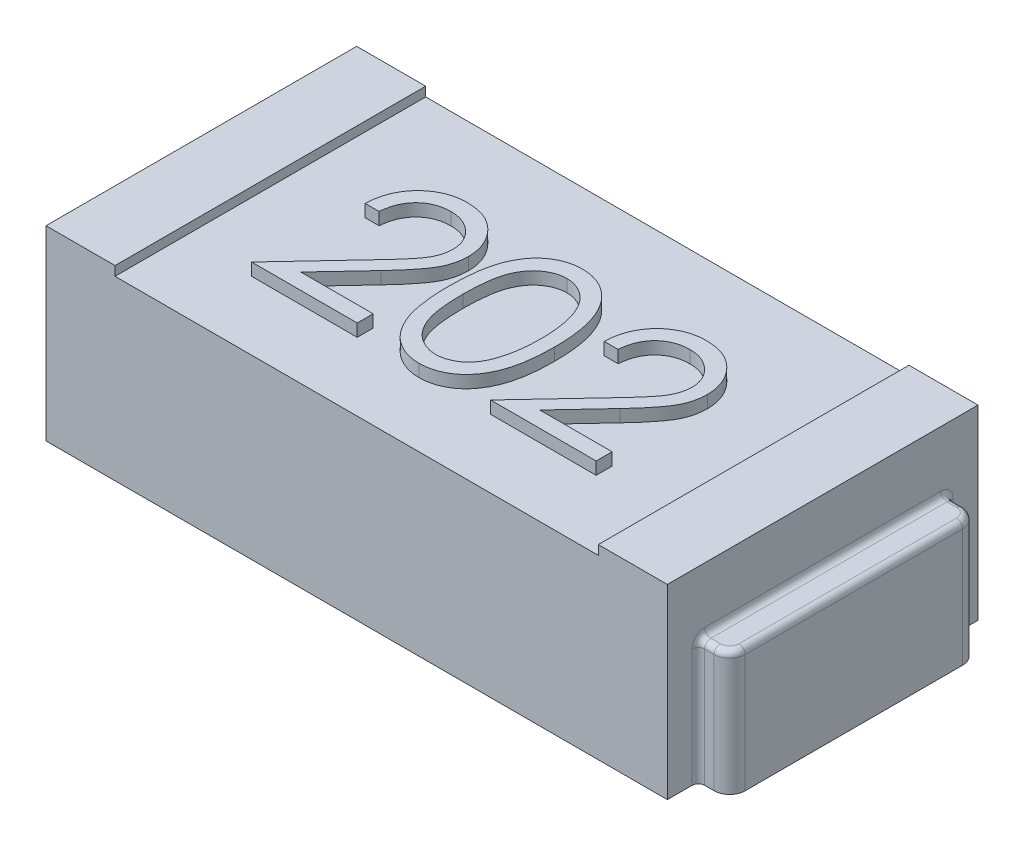
from build123d import *

# Parameters (mm, degrees)
ESQUISSE1_W             = 2
ESQUISSE1_H             = 1
BOSS_EXTRU_1_DEPTH      = 0.6
ESQUISSE2_W             = 1.555645222
ESQUISSE2_H             = 1
ENL_V_MAT_EXTRU_1_DEPTH = 0.03
BOSS_EXTRU_2_DEPTH      = 0.4
CONG_1_R                = 0.02
CONG_1_OF_SYM_TRIE2_R   = 0.02
BOSS_EXTRU_3_DEPTH      = 0.04


with BuildPart() as part:
    # Esquisse1 → Boss.-Extru.1 (new body)
    with BuildSketch(Plane(origin=(0, 0, 0), x_dir=(1, 0, 0), z_dir=(0, 1, 0))):
        Rectangle(ESQUISSE1_W, ESQUISSE1_H)
    extrude(amount=BOSS_EXTRU_1_DEPTH)

    # Esquisse2 → Enlèv. mat.-Extru.1 (cut)
    with BuildSketch(Plane(origin=(0, 0.6, 0), x_dir=(1, 0, 0), z_dir=(0, 1, 0))):
        Rectangle(ESQUISSE2_W, ESQUISSE2_H)
    extrude(amount=-ENL_V_MAT_EXTRU_1_DEPTH, mode=Mode.SUBTRACT)

    # Esquisse3 → Boss.-Extru.2 (add)
    with BuildSketch(Plane(origin=(0, 0, 0), x_dir=(1, 0, 0), z_dir=(0, 1, 0))):
        with BuildLine():
            Line((1, 0.4), (1.050552667, 0.4))
            ThreePointArc((1.050552667, 0.4), (1.085908006, 0.385355339), (1.100552667, 0.35))
            Line((1.100552667, 0.35), (1.100552667, -0.35))
            ThreePointArc((1.100552667, -0.35), (1.085908006, -0.385355339), (1.050552667, -0.4))
            Line((1.050552667, -0.4), (1, -0.4))
            Line((1, -0.4), (1, 0.4))
        make_face()
    boss_extru_2 = extrude(amount=BOSS_EXTRU_2_DEPTH)

    # Congé1
    cong_1_edges = [part.edges().sort_by_distance(p)[0] for p in [
        (1, 0.2, -0.4),
        (1, 0.2, 0.4),
        (1.025276334, 0.4, -0.4),
        (1.085908006, 0.4, -0.385355339),
        (1.100552667, 0.4, 0),
        (1.085908006, 0.4, 0.385355339),
        (1.025276334, 0.4, 0.4),
        (1, 0.4, 0),
    ]]
    fillet(cong_1_edges, radius=CONG_1_R)

    # Symétrie2: Boss.-Extru.2 across plane
    add(boss_extru_2.mirror(Plane(origin=(0, 0, 0), x_dir=(0, 0, 1), z_dir=(1, 0, 0))))

    # Congé1 of Symétrie2
    cong_1_of_sym_trie2_edges = [part.edges().sort_by_distance(p)[0] for p in [
        (-1, 0.2, -0.4),
        (-1, 0.2, 0.4),
        (-1.025276334, 0.4, -0.4),
        (-1.085908006, 0.4, -0.385355339),
        (-1.100552667, 0.4, 0),
        (-1.085908006, 0.4, 0.385355339),
        (-1.025276334, 0.4, 0.4),
        (-1, 0.4, 0),
    ]]
    fillet(cong_1_of_sym_trie2_edges, radius=CONG_1_OF_SYM_TRIE2_R)

    # Esquisse4 → Boss.-Extru.3 (add)
    # profile 1 of 3: a face of its own
    with BuildSketch(Plane(origin=(0, 0.57, 0), x_dir=(1, 0, 0), z_dir=(0, 1, 0))):
        with BuildLine():
            Line((0.275641026, 0.065854324), (0.230769231, 0.065854324))
            add(Edge.make_bspline(
                [(0.230769231, 0.065854324), (0.231061681, 0.071807307), (0.231636046, 0.08349881), (0.234325802, 0.100545082), (0.238174498, 0.116838625), (0.243616135, 0.132248612), (0.250374174, 0.146911299), (0.258478464, 0.160768444), (0.268077586, 0.173767185), (0.278964262, 0.18578702), (0.290788353, 0.196813816), (0.303546344, 0.206335994), (0.316952777, 0.214381375), (0.330966977, 0.221107267), (0.345747057, 0.226155816), (0.361158894, 0.229901765), (0.377270199, 0.232155528), (0.388247345, 0.232397784), (0.393830128, 0.23252099)],
                knots=[0, 0, 0, 0, 1.10065271, 2.161652631, 3.183658789, 4.190468796, 5.17591951, 6.163126047, 7.15150782, 8.156236427, 9.156009102, 10.134482811, 11.092018607, 12.041330605, 13.001268258, 13.972401359, 14.968799086, 16, 16, 16, 16], degree=3))
            add(Edge.make_bspline(
                [(0.393830128, 0.23252099), (0.39931271, 0.232392639), (0.410085788, 0.232140434), (0.425808933, 0.229974573), (0.440777118, 0.226582346), (0.454961085, 0.221823), (0.468247665, 0.215425225), (0.480736672, 0.207739862), (0.492576787, 0.198851315), (0.503234899, 0.188386485), (0.513021768, 0.177214715), (0.521464947, 0.165287872), (0.528695399, 0.152969403), (0.53472221, 0.140165374), (0.539158802, 0.126755227), (0.542527117, 0.112934198), (0.544431033, 0.098559225), (0.544723237, 0.088829717), (0.544871795, 0.08388317)],
                knots=[0, 0, 0, 0, 1.111607364, 2.184268762, 3.212621178, 4.221274766, 5.211760367, 6.196651075, 7.1921475, 8.207485113, 9.220403448, 10.201281604, 11.166441695, 12.114753415, 13.065576456, 14.026450734, 14.996634279, 16, 16, 16, 16], degree=3))
            add(Edge.make_bspline(
                [(0.544871795, 0.08388317), (0.5446299, 0.076919193), (0.544150356, 0.063113449), (0.540048302, 0.042825611), (0.533641657, 0.023169408), (0.525927749, 0.007349794), (0.518145972, -0.005397848), (0.511133471, -0.015893378), (0.502924212, -0.027194159), (0.493398712, -0.03926235), (0.482754016, -0.052192479), (0.470893707, -0.065976736), (0.45773321, -0.080472703), (0.448496281, -0.090373503), (0.443709936, -0.09550385)],
                knots=[0, 0, 0, 0, 1.184426356, 2.348067706, 3.509069118, 4.696110526, 5.333549288, 6.050745305, 6.844228056, 7.710549037, 8.667450064, 9.695053472, 10.805634456, 12, 12, 12, 12], degree=3))
            Line((0.443709936, -0.09550385), (0.318609776, -0.229017471))
            Line((0.318609776, -0.229017471), (0.551282051, -0.229017471))
            Line((0.551282051, -0.229017471), (0.551282051, -0.280299523))
            Line((0.551282051, -0.280299523), (0.211538462, -0.280299523))
            Line((0.211538462, -0.280299523), (0.405448718, -0.073368433))
            add(Edge.make_bspline(
                [(0.405448718, -0.073368433), (0.410169845, -0.068440103), (0.419238163, -0.058973791), (0.432064245, -0.045153368), (0.443584101, -0.032332005), (0.4538723, -0.020533927), (0.462705658, -0.00958656), (0.470544548, 0.000155541), (0.476825347, 0.009120462), (0.483641832, 0.019511978), (0.490243829, 0.032199452), (0.495917023, 0.047704265), (0.499376287, 0.063665301), (0.499791263, 0.074451306), (0.5, 0.079876759)],
                knots=[0, 0, 0, 0, 1.329631726, 2.553950428, 3.673215718, 4.687767853, 5.603093632, 6.413772471, 7.123043292, 7.734684054, 8.834405432, 9.900288307, 10.943827018, 12, 12, 12, 12], degree=3))
            add(Edge.make_bspline(
                [(0.5, 0.079876759), (0.49990918, 0.083288388), (0.49973019, 0.090012052), (0.498150519, 0.099870018), (0.495763304, 0.109379277), (0.492342553, 0.11856908), (0.487827304, 0.12734703), (0.482331107, 0.135723813), (0.47598967, 0.143822236), (0.468653774, 0.151415565), (0.460594985, 0.158370023), (0.452081521, 0.164530606), (0.443074363, 0.169679051), (0.433611489, 0.17389955), (0.423719279, 0.177210319), (0.413378601, 0.179504402), (0.402618027, 0.180944757), (0.395270385, 0.181139638), (0.391526442, 0.181238939)],
                knots=[0, 0, 0, 0, 0.991446411, 1.95395049, 2.89581595, 3.838931463, 4.798493298, 5.75982156, 6.748411868, 7.785213223, 8.824556874, 9.840280684, 10.836137867, 11.835679398, 12.848801643, 13.863922112, 14.911575587, 16, 16, 16, 16], degree=3))
            add(Edge.make_bspline(
                [(0.391526442, 0.181238939), (0.387616323, 0.181136791), (0.379937495, 0.180936191), (0.368663348, 0.179532953), (0.357908237, 0.177112119), (0.347645108, 0.173801165), (0.337856595, 0.169592801), (0.328590303, 0.164351123), (0.319867034, 0.158096338), (0.311670387, 0.15100483), (0.30411839, 0.143109459), (0.297483122, 0.134308036), (0.291685406, 0.124761262), (0.286626944, 0.114494898), (0.282518988, 0.103415786), (0.279379967, 0.091563257), (0.276896132, 0.078988774), (0.276066343, 0.07030519), (0.275641026, 0.065854324)],
                knots=[0, 0, 0, 0, 1.031018746, 2.02475058, 2.990194455, 3.934040569, 4.864654155, 5.795059489, 6.735614925, 7.690564532, 8.649604399, 9.611025574, 10.590972636, 11.591080095, 12.624614302, 13.701020113, 14.821632451, 16, 16, 16, 16], degree=3))
        make_face()
    # profile 2 of 3: a face of its own
    with BuildSketch(Plane(origin=(0, 0.57, 0), x_dir=(1, 0, 0), z_dir=(0, 1, 0))):
        with BuildLine():
            add(Edge.make_bspline(
                [(-0.173076923, -0.030499843), (-0.173030063, -0.022485931), (-0.172939038, -0.00691879), (-0.171926406, 0.01576473), (-0.170244214, 0.037044772), (-0.167938875, 0.056922352), (-0.16513345, 0.075402605), (-0.16138838, 0.092436141), (-0.157129408, 0.108101799), (-0.152193345, 0.122450663), (-0.14662366, 0.13567605), (-0.140561623, 0.148022507), (-0.133766653, 0.159471354), (-0.126627094, 0.170205324), (-0.11885394, 0.180048709), (-0.110668399, 0.189140518), (-0.101750988, 0.197270626), (-0.092404844, 0.20467724), (-0.082545349, 0.211170022), (-0.07245354, 0.216888984), (-0.062059953, 0.22177468), (-0.051336213, 0.225616171), (-0.040378704, 0.228789149), (-0.029149123, 0.230958998), (-0.017628929, 0.232324271), (-0.009853009, 0.232454795), (-0.005909455, 0.23252099)],
                knots=[0, 0, 0, 0, 1.646270934, 3.197905019, 4.663502075, 6.030701355, 7.308322542, 8.50163776, 9.611534131, 10.641858119, 11.616356847, 12.558055219, 13.465016945, 14.349605745, 15.204443733, 16.039544428, 16.859896111, 17.680448484, 18.487036065, 19.28249412, 20.06191084, 20.843045899, 21.620316918, 22.403196591, 23.190181807, 24, 24, 24, 24], degree=3))
            add(Edge.make_bspline(
                [(-0.005909455, 0.23252099), (-0.001932958, 0.232451302), (0.005975043, 0.232312715), (0.017666525, 0.230980723), (0.029087908, 0.228770563), (0.0401905, 0.225638995), (0.051065498, 0.221753898), (0.061627842, 0.21688431), (0.071943139, 0.211215901), (0.081847466, 0.204555347), (0.091449554, 0.197129307), (0.100513548, 0.18873464), (0.109040275, 0.179456109), (0.117136747, 0.169392986), (0.124573261, 0.158352259), (0.13165518, 0.146525958), (0.137994042, 0.133707263), (0.144098996, 0.120110053), (0.149368565, 0.105358102), (0.154120886, 0.089534565), (0.157960739, 0.072452538), (0.161159206, 0.054201646), (0.163637048, 0.034714862), (0.165441712, 0.01403396), (0.16639501, -0.007854667), (0.166574538, -0.022820074), (0.166666667, -0.030499843)],
                knots=[0, 0, 0, 0, 0.810914788, 1.612654377, 2.396697861, 3.181598691, 3.963628158, 4.749916497, 5.551656086, 6.361998678, 7.18212741, 8.025565596, 8.878627764, 9.750805457, 10.657531673, 11.591944965, 12.560506719, 13.57287815, 14.630710178, 15.753379473, 16.941251878, 18.199788006, 19.531962791, 20.947069417, 22.433333509, 24, 24, 24, 24], degree=3))
            add(Edge.make_bspline(
                [(0.166666667, -0.030499843), (0.166573583, -0.038146116), (0.166392214, -0.053044566), (0.165452398, -0.074834705), (0.163601165, -0.095405854), (0.161285453, -0.114807349), (0.158078172, -0.132958437), (0.154134577, -0.14992193), (0.14975596, -0.165771083), (0.144350989, -0.180376056), (0.138435173, -0.193940588), (0.131998717, -0.206607324), (0.125103027, -0.218488222), (0.117590349, -0.229488186), (0.109582719, -0.239685137), (0.100908749, -0.248899083), (0.091812951, -0.257352037), (0.082182606, -0.264873698), (0.072123813, -0.271457241), (0.061843945, -0.277344934), (0.051160605, -0.282092462), (0.040315897, -0.286168896), (0.029154702, -0.289283247), (0.017690932, -0.291436655), (0.005982898, -0.292946919), (-0.001931611, -0.29306213), (-0.005909455, -0.293120035)],
                knots=[0, 0, 0, 0, 1.561518951, 3.042555995, 4.452378317, 5.7783523, 7.031515105, 8.214008947, 9.334062868, 10.386615937, 11.391082383, 12.354592575, 13.286541444, 14.194233754, 15.072674879, 15.931287219, 16.775624067, 17.606195743, 18.42308326, 19.229000347, 20.022332153, 20.807536673, 21.593273796, 22.3848459, 23.188221202, 24, 24, 24, 24], degree=3))
            add(Edge.make_bspline(
                [(-0.005909455, -0.293120035), (-0.0098529, -0.293053413), (-0.017628604, -0.292922047), (-0.029150379, -0.291562943), (-0.040333585, -0.289377871), (-0.051233407, -0.286318356), (-0.061905766, -0.282573379), (-0.072205236, -0.277694282), (-0.082246333, -0.272075129), (-0.09200227, -0.265675783), (-0.101289721, -0.258344114), (-0.110160951, -0.25023493), (-0.118393096, -0.241145871), (-0.12605511, -0.231220454), (-0.133337123, -0.22054999), (-0.140035605, -0.208988794), (-0.146231441, -0.196582707), (-0.151894797, -0.183251577), (-0.156916034, -0.168800873), (-0.161351421, -0.153065276), (-0.164853444, -0.135905899), (-0.167851009, -0.117460561), (-0.170268778, -0.09765), (-0.171919396, -0.07646346), (-0.172939583, -0.053914145), (-0.173030308, -0.038447034), (-0.173076923, -0.030499843)],
                knots=[0, 0, 0, 0, 0.810891512, 1.598919785, 2.382837074, 3.152667961, 3.926044502, 4.706494248, 5.493654104, 6.291793342, 7.103789334, 7.925228297, 8.761435821, 9.622817696, 10.50288917, 11.416980706, 12.369136599, 13.353924996, 14.394355917, 15.514179734, 16.714354668, 17.994756427, 19.357759367, 20.818452758, 22.365282078, 24, 24, 24, 24], degree=3))
        make_face()
        with BuildLine():
            add(Edge.make_bspline(
                [(-0.128205128, -0.030299523), (-0.128188064, -0.036977908), (-0.128154947, -0.049939343), (-0.127289775, -0.068774095), (-0.126111171, -0.086341285), (-0.124590985, -0.102663218), (-0.122333421, -0.117684649), (-0.11980388, -0.131508889), (-0.116725582, -0.14406278), (-0.113083436, -0.155432467), (-0.108934994, -0.165810906), (-0.104405585, -0.175468222), (-0.099539767, -0.184518499), (-0.094094174, -0.192880443), (-0.088163451, -0.200581323), (-0.081881557, -0.207757442), (-0.075014045, -0.214157011), (-0.06551351, -0.221832276), (-0.052971157, -0.229763581), (-0.037168234, -0.236670165), (-0.020929884, -0.241010516), (-0.009908277, -0.241562481), (-0.004407051, -0.241837984)],
                knots=[0, 0, 0, 0, 1.459021318, 2.831673884, 4.118529203, 5.306027144, 6.411944654, 7.436330062, 8.375795394, 9.233974572, 10.042671642, 10.816086306, 11.563610507, 12.285937304, 12.993564865, 13.685989202, 14.367179055, 15.041617293, 16.353048772, 17.594441528, 18.799311195, 20, 20, 20, 20], degree=3))
            add(Edge.make_bspline(
                [(-0.004407051, -0.241837984), (0.001129759, -0.24160973), (0.012191948, -0.241153692), (0.028353919, -0.236753873), (0.044043957, -0.230115367), (0.056339949, -0.222265723), (0.065694598, -0.214790248), (0.072397025, -0.208416726), (0.078548746, -0.201280174), (0.084383328, -0.193580275), (0.089734625, -0.18516992), (0.094600787, -0.176089552), (0.099041266, -0.166313955), (0.101571129, -0.159489707), (0.102864583, -0.156000644)],
                knots=[0, 0, 0, 0, 1.353760809, 2.704726607, 4.075137775, 5.516104923, 6.260822281, 7.007110065, 7.778089737, 8.566572457, 9.372053459, 10.217411131, 11.088608312, 12, 12, 12, 12], degree=3))
            add(Edge.make_bspline(
                [(0.102864583, -0.156000644), (0.104371979, -0.151539253), (0.107432638, -0.142480715), (0.111377177, -0.128428765), (0.114483663, -0.113685513), (0.117278429, -0.098339068), (0.119186009, -0.082276253), (0.12072141, -0.06554677), (0.121625794, -0.048138004), (0.121737902, -0.036310148), (0.121794872, -0.030299523)],
                knots=[0, 0, 0, 0, 0.884706709, 1.796334032, 2.740027952, 3.714592787, 4.726048262, 5.777819803, 6.87074269, 8, 8, 8, 8], degree=3))
            add(Edge.make_bspline(
                [(0.121794872, -0.030299523), (0.121716273, -0.024289869), (0.121562518, -0.012533703), (0.120974805, 0.00468318), (0.119457152, 0.021035717), (0.117771564, 0.036594356), (0.115286246, 0.051272971), (0.11260656, 0.065194443), (0.109006386, 0.078186304), (0.105160704, 0.090451958), (0.100759219, 0.101852052), (0.095914114, 0.112439736), (0.090739577, 0.122266125), (0.085119257, 0.131304259), (0.079119874, 0.139594623), (0.072583081, 0.146970993), (0.065768171, 0.153661989), (0.056222858, 0.161299499), (0.043726531, 0.169086884), (0.028177153, 0.176253421), (0.011995633, 0.180368891), (0.001056568, 0.180949132), (-0.004407051, 0.181238939)],
                knots=[0, 0, 0, 0, 1.31362396, 2.569729283, 3.763502607, 4.902122613, 5.988968491, 7.01645872, 7.998833611, 8.933434873, 9.825090667, 10.667526885, 11.477055099, 12.250526234, 12.991942729, 13.710640831, 14.402115721, 15.076753259, 16.378508321, 17.609869233, 18.806226677, 20, 20, 20, 20], degree=3))
            add(Edge.make_bspline(
                [(-0.004407051, 0.181238939), (-0.009937136, 0.180948732), (-0.02100738, 0.18036779), (-0.037357087, 0.176268754), (-0.053029138, 0.169124045), (-0.06549242, 0.161273706), (-0.075044389, 0.153796804), (-0.081770488, 0.147313025), (-0.088077084, 0.140220703), (-0.093886756, 0.132449001), (-0.099328082, 0.124096805), (-0.104325369, 0.11509841), (-0.108827845, 0.105408216), (-0.112982779, 0.095034439), (-0.116636034, 0.083665733), (-0.119649458, 0.071127305), (-0.122433322, 0.057347035), (-0.124404075, 0.042244248), (-0.12615604, 0.025918226), (-0.127281947, 0.008307181), (-0.128157841, -0.01055916), (-0.12818905, -0.023587611), (-0.128205128, -0.030299523)],
                knots=[0, 0, 0, 0, 1.207732386, 2.417664972, 3.655092373, 4.956220595, 5.625982001, 6.301752483, 6.994047911, 7.697131622, 8.419323945, 9.170223765, 9.943494443, 10.752040957, 11.610060368, 12.549350801, 13.567764191, 14.679664412, 15.874934091, 17.154273443, 18.533957287, 20, 20, 20, 20], degree=3))
        make_face(mode=Mode.SUBTRACT)
    # profile 3 of 3: a face of its own
    with BuildSketch(Plane(origin=(0, 0.57, 0), x_dir=(1, 0, 0), z_dir=(0, 1, 0))):
        with BuildLine():
            Line((-0.493589744, 0.065854324), (-0.538461538, 0.065854324))
            add(Edge.make_bspline(
                [(-0.538461538, 0.065854324), (-0.538169088, 0.071807307), (-0.537594723, 0.08349881), (-0.534904968, 0.100545082), (-0.531056271, 0.116838625), (-0.525614635, 0.132248612), (-0.518856595, 0.146911299), (-0.510752305, 0.160768444), (-0.501153184, 0.173767185), (-0.490266507, 0.18578702), (-0.478442416, 0.196813816), (-0.465684425, 0.206335994), (-0.452277992, 0.214381375), (-0.438263792, 0.221107267), (-0.423483712, 0.226155816), (-0.408071875, 0.229901765), (-0.39196057, 0.232155528), (-0.380983424, 0.232397784), (-0.375400641, 0.23252099)],
                knots=[0, 0, 0, 0, 1.10065271, 2.161652631, 3.183658789, 4.190468796, 5.17591951, 6.163126047, 7.15150782, 8.156236427, 9.156009102, 10.134482811, 11.092018607, 12.041330605, 13.001268258, 13.972401359, 14.968799086, 16, 16, 16, 16], degree=3))
            add(Edge.make_bspline(
                [(-0.375400641, 0.23252099), (-0.369918059, 0.232392639), (-0.359144981, 0.232140434), (-0.343421836, 0.229974573), (-0.328453651, 0.226582346), (-0.314269685, 0.221823), (-0.300983104, 0.215425225), (-0.288494098, 0.207739862), (-0.276653982, 0.198851315), (-0.26599587, 0.188386485), (-0.256209001, 0.177214715), (-0.247765822, 0.165287872), (-0.24053537, 0.152969403), (-0.234508559, 0.140165374), (-0.230071968, 0.126755227), (-0.226703652, 0.112934198), (-0.224799736, 0.098559225), (-0.224507533, 0.088829717), (-0.224358974, 0.08388317)],
                knots=[0, 0, 0, 0, 1.111607364, 2.184268762, 3.212621178, 4.221274766, 5.211760367, 6.196651075, 7.1921475, 8.207485113, 9.220403448, 10.201281604, 11.166441695, 12.114753415, 13.065576456, 14.026450734, 14.996634279, 16, 16, 16, 16], degree=3))
            add(Edge.make_bspline(
                [(-0.224358974, 0.08388317), (-0.224600869, 0.076919193), (-0.225080414, 0.063113449), (-0.229182467, 0.042825611), (-0.235589112, 0.023169408), (-0.24330302, 0.007349794), (-0.251084798, -0.005397848), (-0.258097299, -0.015893378), (-0.266306557, -0.027194159), (-0.275832057, -0.03926235), (-0.286476753, -0.052192479), (-0.298337062, -0.065976736), (-0.31149756, -0.080472703), (-0.320734488, -0.090373503), (-0.325520833, -0.09550385)],
                knots=[0, 0, 0, 0, 1.184426356, 2.348067706, 3.509069118, 4.696110526, 5.333549288, 6.050745305, 6.844228056, 7.710549037, 8.667450064, 9.695053472, 10.805634456, 12, 12, 12, 12], degree=3))
            Line((-0.325520833, -0.09550385), (-0.450620994, -0.229017471))
            Line((-0.450620994, -0.229017471), (-0.217948718, -0.229017471))
            Line((-0.217948718, -0.229017471), (-0.217948718, -0.280299523))
            Line((-0.217948718, -0.280299523), (-0.557692308, -0.280299523))
            Line((-0.557692308, -0.280299523), (-0.363782051, -0.073368433))
            add(Edge.make_bspline(
                [(-0.363782051, -0.073368433), (-0.359060925, -0.068440103), (-0.349992606, -0.058973791), (-0.337166524, -0.045153368), (-0.325646669, -0.032332005), (-0.31535847, -0.020533927), (-0.306525112, -0.00958656), (-0.298686221, 0.000155541), (-0.292405423, 0.009120462), (-0.285588938, 0.019511978), (-0.27898694, 0.032199452), (-0.273313747, 0.047704265), (-0.269854482, 0.063665301), (-0.269439506, 0.074451306), (-0.269230769, 0.079876759)],
                knots=[0, 0, 0, 0, 1.329631726, 2.553950428, 3.673215718, 4.687767853, 5.603093632, 6.413772471, 7.123043292, 7.734684054, 8.834405432, 9.900288307, 10.943827018, 12, 12, 12, 12], degree=3))
            add(Edge.make_bspline(
                [(-0.269230769, 0.079876759), (-0.26932159, 0.083288388), (-0.269500579, 0.090012052), (-0.27108025, 0.099870018), (-0.273467465, 0.109379277), (-0.276888216, 0.11856908), (-0.281403465, 0.12734703), (-0.286899662, 0.135723813), (-0.2932411, 0.143822236), (-0.300576995, 0.151415565), (-0.308635784, 0.158370023), (-0.317149248, 0.164530606), (-0.326156406, 0.169679051), (-0.33561928, 0.17389955), (-0.34551149, 0.177210319), (-0.355852168, 0.179504402), (-0.366612742, 0.180944757), (-0.373960384, 0.181139638), (-0.377704327, 0.181238939)],
                knots=[0, 0, 0, 0, 0.991446411, 1.95395049, 2.89581595, 3.838931463, 4.798493298, 5.75982156, 6.748411868, 7.785213223, 8.824556874, 9.840280684, 10.836137867, 11.835679398, 12.848801643, 13.863922112, 14.911575587, 16, 16, 16, 16], degree=3))
            add(Edge.make_bspline(
                [(-0.377704327, 0.181238939), (-0.381614446, 0.181136791), (-0.389293274, 0.180936191), (-0.400567421, 0.179532953), (-0.411322533, 0.177112119), (-0.421585662, 0.173801165), (-0.431374174, 0.169592801), (-0.440640466, 0.164351123), (-0.449363736, 0.158096338), (-0.457560382, 0.15100483), (-0.465112379, 0.143109459), (-0.471747647, 0.134308036), (-0.477545363, 0.124761262), (-0.482603825, 0.114494898), (-0.486711781, 0.103415786), (-0.489850802, 0.091563257), (-0.492334638, 0.078988774), (-0.493164426, 0.07030519), (-0.493589744, 0.065854324)],
                knots=[0, 0, 0, 0, 1.031018746, 2.02475058, 2.990194455, 3.934040569, 4.864654155, 5.795059489, 6.735614925, 7.690564532, 8.649604399, 9.611025574, 10.590972636, 11.591080095, 12.624614302, 13.701020113, 14.821632451, 16, 16, 16, 16], degree=3))
        make_face()
    extrude(amount=BOSS_EXTRU_3_DEPTH)


solid = part.part
